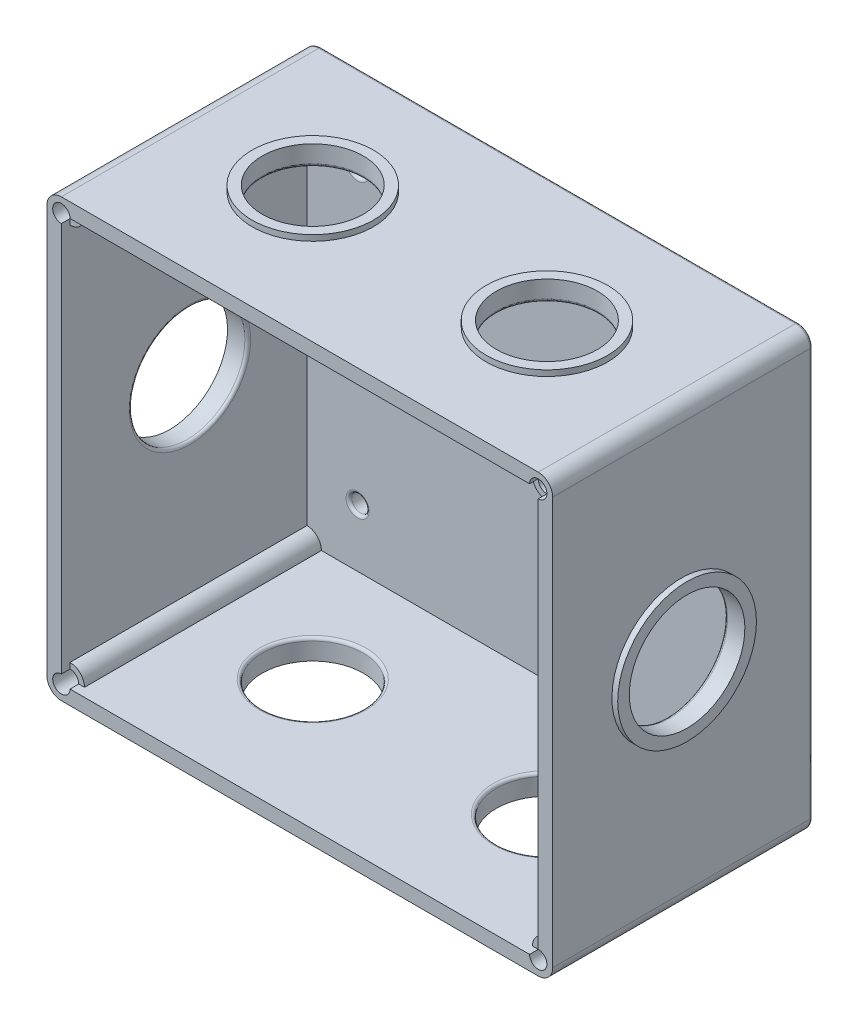
from build123d import *

# Parameters (mm, degrees)
BOSS_EXTRU_1_DEPTH      = 90
COQUE1_START            = 5
COQUE1_OUTLINE_W        = 141
COQUE1_OUTLINE_H        = 85
COQUE1_DEPTH            = 165
BOSS_EXTRU_2_DEPTH      = 82
ESQUISSE3_R             = 3
ENL_V_MAT_EXTRU_1_DEPTH = 18
ESQUISSE4_R             = 3
ENL_V_MAT_EXTRU_2_DEPTH = 5
ESQUISSE5_R             = 17.5
ENL_V_MAT_EXTRU_3_DEPTH = 165
BOSS_EXTRU_3_START      = 2
ESQUISSE7_R             = 21
ESQUISSE7_R_2           = 17.5
BOSS_EXTRU_3_DEPTH      = 2
ESQUISSE8_R             = 21
ESQUISSE8_R_2           = 17.5
BOSS_EXTRU_4_DEPTH      = 2
CONG_1_R                = 1
CONG_2_R                = 1
CONG_3_R                = 1
ESQUISSE9_R             = 20
ENL_V_MAT_EXTRU_4_DEPTH = 192
CONG_4_R                = 1
BOSS_EXTRU_5_START      = 2
ESQUISSE10_R            = 24
ESQUISSE10_R_2          = 20
BOSS_EXTRU_5_DEPTH      = 2
ESQUISSE11_R            = 24
ESQUISSE11_R_2          = 20
BOSS_EXTRU_6_DEPTH      = 2


# Read off the part's stored shape, not the designer's step: Coque1
with BuildPart() as part:
    # Esquisse1 → Boss.-Extru.1 (new body)
    with BuildSketch(Plane.XY):
        with BuildLine():
            Line((5, 0), (170, 0))
            ThreePointArc((170, 0), (173.535533906, 1.464466094), (175, 5))
            Line((175, 5), (175, 146))
            ThreePointArc((175, 146), (173.535533906, 149.535533906), (170, 151))
            Line((170, 151), (5, 151))
            ThreePointArc((5, 151), (1.464466094, 149.535533906), (0, 146))
            Line((0, 146), (0, 5))
            ThreePointArc((0, 5), (1.464466094, 1.464466094), (5, 0))
        make_face()
    extrude(amount=BOSS_EXTRU_1_DEPTH)

    # Coque1 outline → Coque1 (cut)
    with BuildSketch(Plane.YZ.offset(COQUE1_START)):
        with Locations((75.5, 47.5)):
            Rectangle(COQUE1_OUTLINE_W, COQUE1_OUTLINE_H)
    extrude(amount=COQUE1_DEPTH, mode=Mode.SUBTRACT)

    # Esquisse2 → Boss.-Extru.2 (add)
    with BuildSketch(Plane.XY.offset(5)):
        with BuildLine():
            Line((5, 141.007754636), (5, 146))
            Line((5, 146), (9.992245364, 146))
            ThreePointArc((9.992245364, 146), (8.53005055, 142.46994945), (5, 141.007754636))
        make_face()
        with BuildLine():
            Line((170, 146), (165.007754636, 146))
            ThreePointArc((165.007754636, 146), (166.46994945, 142.46994945), (170, 141.007754636))
            Line((170, 141.007754636), (170, 146))
        make_face()
        with BuildLine():
            Line((170, 5), (165.007754636, 5))
            ThreePointArc((165.007754636, 5), (166.46994945, 8.53005055), (170, 9.992245364))
            Line((170, 9.992245364), (170, 5))
        make_face()
        with BuildLine():
            Line((5, 9.992245364), (5, 5))
            Line((5, 5), (9.992245364, 5))
            ThreePointArc((9.992245364, 5), (8.53005055, 8.53005055), (5, 9.992245364))
        make_face()
    extrude(amount=BOSS_EXTRU_2_DEPTH)

    # Esquisse3 → Enlèv. mat.-Extru.1 (cut)
    with BuildSketch(Plane.XY.offset(90)):
        with Locations((5, 146)):
            Circle(ESQUISSE3_R)
        with Locations(Location((170, 146, 0), (0, 0, 180))):
            Circle(ESQUISSE3_R)
        with Locations((170, 5)):
            Circle(ESQUISSE3_R)
        with Locations((5, 5)):
            Circle(ESQUISSE3_R)
    extrude(amount=-ENL_V_MAT_EXTRU_1_DEPTH, mode=Mode.SUBTRACT)

    # Esquisse4 → Enlèv. mat.-Extru.2 (cut)
    with BuildSketch(Plane.XY.offset(5)):
        with Locations((22.504830405, 125.990498119)):
            Circle(ESQUISSE4_R)
        with Locations(Location((152.495169595, 125.990498119, 0), (0, 0, 180))):
            Circle(ESQUISSE4_R)
        with Locations((152.495169595, 25.009501881)):
            Circle(ESQUISSE4_R)
        with Locations(Location((22.504830405, 25.009501881, 0), (0, 0, 180))):
            Circle(ESQUISSE4_R)
        with Locations((128.75, 75.5)):
            Circle(ESQUISSE4_R)
        with Locations(Location((46.25, 75.5, 0), (0, 0, 180))):
            Circle(ESQUISSE4_R)
    extrude(amount=-ENL_V_MAT_EXTRU_2_DEPTH, mode=Mode.SUBTRACT)

    # Esquisse5 → Enlèv. mat.-Extru.3 (cut)
    with BuildSketch(Plane(origin=(0, 151, 0), x_dir=(1, 0, 0), z_dir=(0, 1, 0))):
        with Locations(Location((128.018344025, -45, 0), (0, 0, 270))):
            Circle(ESQUISSE5_R)
        with Locations(Location((46.981655975, -45, 0), (0, 0, 270))):
            Circle(ESQUISSE5_R)
    extrude(amount=-ENL_V_MAT_EXTRU_3_DEPTH, mode=Mode.SUBTRACT)

    # Esquisse7 → Boss.-Extru.3 (add)
    # profile 1 of 2: a face of its own
    with BuildSketch(Plane(origin=(0, 151, 0), x_dir=(1, 0, 0), z_dir=(0, 1, 0)).offset(BOSS_EXTRU_3_START)):
        with Locations(Location((128.018344025, -45, 0), (0, 0, 90))):
            Circle(ESQUISSE7_R)
        with Locations(Location((128.018344025, -45, 0), (0, 0, 270))):
            Circle(ESQUISSE7_R_2, mode=Mode.SUBTRACT)
    # profile 2 of 2: a face of its own
    with BuildSketch(Plane(origin=(0, 151, 0), x_dir=(1, 0, 0), z_dir=(0, 1, 0)).offset(BOSS_EXTRU_3_START)):
        with Locations(Location((46.981655975, -45, 0), (0, 0, 90))):
            Circle(ESQUISSE7_R)
        with Locations(Location((46.981655975, -45, 0), (0, 0, 270))):
            Circle(ESQUISSE7_R_2, mode=Mode.SUBTRACT)
    extrude(amount=-BOSS_EXTRU_3_DEPTH)

    # Esquisse8 → Boss.-Extru.4 (add)
    # profile 1 of 2: a face of its own
    with BuildSketch(Plane.XZ):
        with Locations(Location((46.981655975, 45, 0), (0, 0, 270))):
            Circle(ESQUISSE8_R)
        with Locations(Location((46.981655975, 45, 0), (0, 0, 90))):
            Circle(ESQUISSE8_R_2, mode=Mode.SUBTRACT)
    # profile 2 of 2: a face of its own
    with BuildSketch(Plane.XZ):
        with Locations(Location((128.018344025, 45, 0), (0, 0, 270))):
            Circle(ESQUISSE8_R)
        with Locations(Location((128.018344025, 45, 0), (0, 0, 90))):
            Circle(ESQUISSE8_R_2, mode=Mode.SUBTRACT)
    extrude(amount=BOSS_EXTRU_4_DEPTH)

    # Congé1
    cong_1_edges = [part.edges().sort_by_distance(p)[0] for p in [
        (128.018344025, 146, 27.5),
        (128.018344025, 5, 27.5),
        (46.981655975, 146, 27.5),
        (46.981655975, 5, 27.5),
    ]]
    fillet(cong_1_edges, radius=CONG_1_R)

    # Congé2
    cong_2_edges = [part.edges().sort_by_distance(p)[0] for p in [
        (155.495169595, 125.990498119, 5),
        (149.495169595, 25.009501881, 5),
        (25.504830405, 25.009501881, 5),
        (19.504830405, 125.990498119, 5),
    ]]
    fillet(cong_2_edges, radius=CONG_2_R)

    # Congé3
    cong_3_edges = [part.edges().sort_by_distance(p)[0] for p in [
        (87.5, 151, 0),
        (173.535533906, 149.535533906, 0),
        (175, 75.5, 0),
        (173.535533906, 1.464466094, 0),
        (87.5, 0, 0),
        (1.464466094, 1.464466094, 0),
        (0, 75.5, 0),
        (1.464466094, 149.535533906, 0),
    ]]
    fillet(cong_3_edges, radius=CONG_3_R)

    # Esquisse9 → Enlèv. mat.-Extru.4 (cut)
    with BuildSketch(Plane.ZY):
        with Locations(Location((45.5, 75.5, 0), (0, 0, 270))):
            Circle(ESQUISSE9_R)
    extrude(amount=-ENL_V_MAT_EXTRU_4_DEPTH, mode=Mode.SUBTRACT)

    # Congé4
    cong_4_edges = [part.edges().sort_by_distance(p)[0] for p in [
        (170, 95.5, 45.5),
        (5, 95.5, 45.5),
    ]]
    fillet(cong_4_edges, radius=CONG_4_R)

    # Esquisse10 → Boss.-Extru.5 (add)
    with BuildSketch(Plane.ZY.offset(BOSS_EXTRU_5_START)):
        with Locations(Location((45.5, 75.5, 0), (0, 0, 90))):
            Circle(ESQUISSE10_R)
        with Locations(Location((45.5, 75.5, 0), (0, 0, 270))):
            Circle(ESQUISSE10_R_2, mode=Mode.SUBTRACT)
    extrude(amount=-BOSS_EXTRU_5_DEPTH)

    # Esquisse11 → Boss.-Extru.6 (add)
    with BuildSketch(Plane(origin=(175, 0, 0), x_dir=(0, 0, -1), z_dir=(1, 0, 0))):
        with Locations(Location((-45.5, 75.5, 0), (0, 0, 90))):
            Circle(ESQUISSE11_R)
        with Locations(Location((-45.5, 75.5, 0), (0, 0, 270))):
            Circle(ESQUISSE11_R_2, mode=Mode.SUBTRACT)
    extrude(amount=BOSS_EXTRU_6_DEPTH)


solid = part.part
